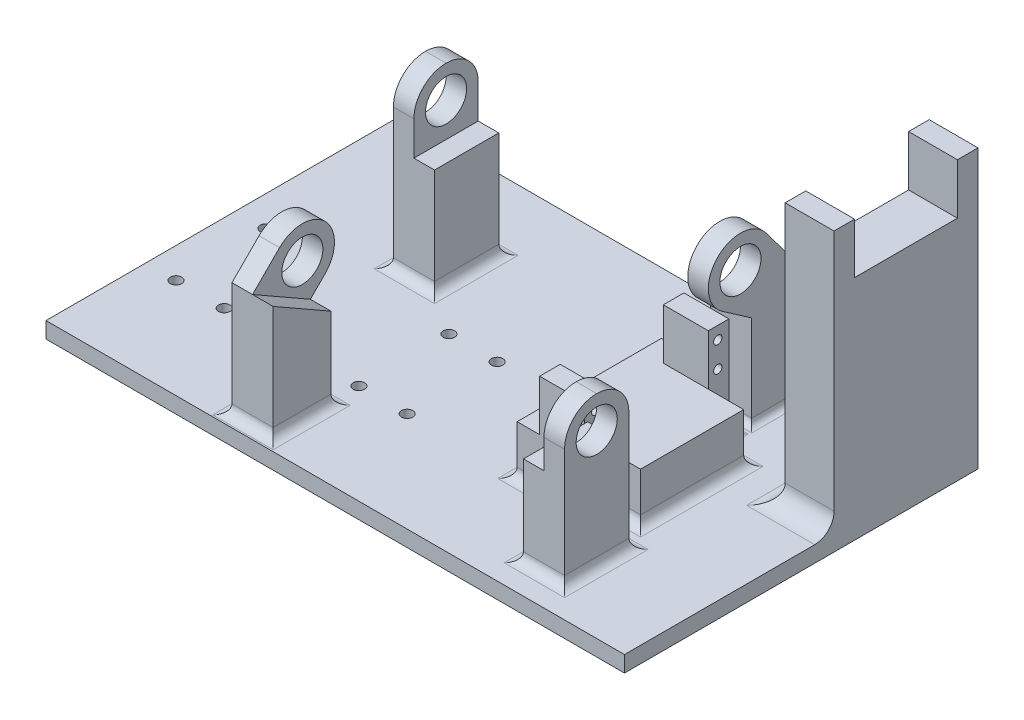
from build123d import *

# Parameters (mm, degrees)
SKETCH2_W            = 228.6
SKETCH2_H            = 139.7
BOSS_EXTRUDE1_DEPTH  = 6.35
SKETCH3_W            = 8.128
SKETCH3_H            = 25.4
BOSS_EXTRUDE2_DEPTH  = 59.69
FILLET3_R            = 12.7
SKETCH5_R            = 8.128
CUT_EXTRUDE1_DEPTH   = 53.34
SKETCH7_W            = 8.128
SKETCH7_H            = 25.4
BOSS_EXTRUDE3_DEPTH  = 35.56
SKETCH8_W            = 8.128
SKETCH8_H            = 22.86
BOSS_EXTRUDE4_DEPTH  = 25.4
BOSS_EXTRUDE5_DEPTH  = 8.128
FILLET4_R            = 12.7
CUT_EXTRUDE2_START   = -8.128
SKETCH10_R           = 8.128
CUT_EXTRUDE2_DEPTH   = 8.128
SKETCH11_W           = 8.128
SKETCH11_H           = 22.86
BOSS_EXTRUDE6_DEPTH  = 32.204488
BOSS_EXTRUDE7_DEPTH  = 8.128
SKETCH13_W           = 40.64
SKETCH13_H           = 40.767
BOSS_EXTRUDE8_DEPTH  = 19.433424
SKETCH14_W           = 26.67
SKETCH14_H           = 8.128
BOSS_EXTRUDE9_DEPTH  = 39.433424
FILLET6_R            = 3.81
SKETCH15_R           = 1.651
CUT_EXTRUDE3_DEPTH   = 12.7
CUT_EXTRUDE4_START   = -20
SKETCH16_W           = 8.89
SKETCH16_H           = 8.128
CUT_EXTRUDE4_DEPTH   = 20
SKETCH17_W           = 8.128
SKETCH17_H           = 25.4
BOSS_EXTRUDE10_DEPTH = 68.072
FILLET7_R            = 12.7
SKETCH20_R           = 8.128
CUT_EXTRUDE5_DEPTH   = 17.78
SKETCH21_W           = 8.128
SKETCH21_H           = 25.4
BOSS_EXTRUDE11_DEPTH = 41.91
FILLET8_R            = 3.81
SKETCH22_W           = 8.128
SKETCH22_H           = 25.4
BOSS_EXTRUDE12_DEPTH = 36.83
BOSS_EXTRUDE13_START = -8.128
SKETCH23_R           = 8.128
BOSS_EXTRUDE13_DEPTH = 8.128
SKETCH24_W           = 8.128
SKETCH24_H           = 25.4
BOSS_EXTRUDE14_DEPTH = 36.83
FILLET10_R           = 2.54
SKETCH26_W           = 19.304
SKETCH26_H           = 56.896
BOSS_EXTRUDE15_DEPTH = 83.546431338
SKETCH27_W           = 19.304
SKETCH27_H           = 8.128
BOSS_EXTRUDE16_DEPTH = 20
SKETCH28_R           = 1.625
CUT_EXTRUDE6_DEPTH   = 8.89
FILLET11_R           = 7.62
SKETCH29_R           = 2.249999945
CUT_EXTRUDE7_DEPTH   = 11.43


# Some blends are built 0.0001 mm under size
with BuildPart() as part:
    # Sketch2 → Boss-Extrude1 (new body)
    with BuildSketch(Plane(origin=(0, 0, 0), x_dir=(1, 0, 0), z_dir=(0, 1, 0))):
        with Locations((-33.692352941, -26.268455882)):
            Rectangle(SKETCH2_W, SKETCH2_H)
    extrude(amount=BOSS_EXTRUDE1_DEPTH)

    # Sketch3 → Boss-Extrude2 (add)
    with BuildSketch(Plane(origin=(0, 6.35, 0), x_dir=(1, 0, 0), z_dir=(0, 1, 0))):
        with Locations((41.440900604, -71.988455882)):
            Rectangle(SKETCH3_W, SKETCH3_H)
    extrude(amount=BOSS_EXTRUDE2_DEPTH)

    # Fillet3
    fillet3_edges = [part.edges().sort_by_distance(p)[0] for p in [
        (41.440900604, 66.04, 84.688455882),
        (41.440900604, 66.04, 59.288455882),
    ]]
    fillet(fillet3_edges, radius=FILLET3_R - 0.0001)  # a hair under: the kernel refuses the full size

    # Sketch5 → Cut-Extrude1 (cut)
    with BuildSketch(Plane(origin=(45.504900604, 0, 0), x_dir=(0, 0, -1), z_dir=(1, 0, 0))):
        with Locations((-71.988455882, 53.34)):
            Circle(SKETCH5_R)
    extrude(amount=-CUT_EXTRUDE1_DEPTH, mode=Mode.SUBTRACT)

    # Sketch7 → Boss-Extrude3 (add)
    with BuildSketch(Plane(origin=(0, 6.35, 0), x_dir=(1, 0, 0), z_dir=(0, 1, 0))):
        with Locations((33.312900604, -71.988455882)):
            Rectangle(SKETCH7_W, SKETCH7_H)
    extrude(amount=BOSS_EXTRUDE3_DEPTH)

    # Sketch8 → Boss-Extrude4 (add)
    with BuildSketch(Plane(origin=(0, 6.35, 0), x_dir=(1, 0, 0), z_dir=(0, 1, 0))):
        with Locations((-74.891099396, -80.243455882)):
            Rectangle(SKETCH8_W, SKETCH8_H)
    extrude(amount=BOSS_EXTRUDE4_DEPTH)

    # Sketch9 → Boss-Extrude5 (add)
    with BuildSketch(Plane.ZY.offset(78.955099396)):
        Polygon((91.673455882, 31.75), (91.673455882, 51.615512242), (71.988455882, 71.300512242), (54.02794364, 53.34), (68.813455882, 38.554487758), (68.813455882, 31.75), align=None)
    extrude(amount=-BOSS_EXTRUDE5_DEPTH)

    # Fillet4
    fillet4_edges = [part.edges().sort_by_distance(p)[0] for p in [
        (-74.891099396, 53.34, 54.02794364),
        (-74.891099396, 71.300512242, 71.988455882),
    ]]
    fillet(fillet4_edges, radius=FILLET4_R - 0.0001)  # a hair under: the kernel refuses the full size

    # Sketch10 → Cut-Extrude2 (cut)
    with BuildSketch(Plane.ZY.offset(78.955099396).offset(CUT_EXTRUDE2_START)):
        with Locations(Location((71.988455882, 53.34, 0), (0, 0, 180))):
            Circle(SKETCH10_R)
    extrude(amount=CUT_EXTRUDE2_DEPTH, mode=Mode.SUBTRACT)

    # Sketch11 → Boss-Extrude6 (add)
    with BuildSketch(Plane(origin=(0, 6.35, 0), x_dir=(1, 0, 0), z_dir=(0, 1, 0))):
        with Locations((-66.763099396, -80.243455882)):
            Rectangle(SKETCH11_W, SKETCH11_H)
    extrude(amount=BOSS_EXTRUDE6_DEPTH)

    # Sketch12 → Boss-Extrude7 (add)
    with BuildSketch(Plane(origin=(-70.827099396, 0, 0), x_dir=(0, 0, -1), z_dir=(1, 0, 0))):
        Polygon((-91.673455882, 51.615512242), (-68.813455882, 38.554487758), (-91.673455882, 38.554487758), align=None)
    extrude(amount=BOSS_EXTRUDE7_DEPTH)

    # Sketch13 → Boss-Extrude8 (add)
    with BuildSketch(Plane(origin=(0, 6.35, 0), x_dir=(1, 0, 0), z_dir=(0, 1, 0))):
        with Locations((19.450377632, -28.554455882)):
            Rectangle(SKETCH13_W, SKETCH13_H)
    extrude(amount=BOSS_EXTRUDE8_DEPTH)

    # Sketch14 → Boss-Extrude9 (add)
    with BuildSketch(Plane(origin=(0, 6.35, 0), x_dir=(1, 0, 0), z_dir=(0, 1, 0))):
        with Locations((12.465377632, -53.001955882)):
            Rectangle(SKETCH14_W, SKETCH14_H)
        with Locations((12.465377632, -4.106955882)):
            Rectangle(SKETCH14_W, SKETCH14_H)
    extrude(amount=BOSS_EXTRUDE9_DEPTH)

    # Fillet6
    # the kernel refuses this fillet: 3.81 mm, written as the material it adds along each edge
    with BuildSketch(Plane(origin=(-62.699099396, 6.35, 91.673455882), x_dir=(1, 0, 0), z_dir=(0, 0, -1)), Plane(origin=(-78.955099396, 6.35, 68.813455882), x_dir=(-1, 0, 0), z_dir=(0, 0, 1))) as fillet6_piece_1:
        with BuildLine():
            CenterArc((FILLET6_R, -FILLET6_R), FILLET6_R, 90, 90)
            Line((0, -FILLET6_R), (0, 0))
            Line((0, 0), (FILLET6_R, 0))
        make_face()
    extrude(amount=22.86)
    with BuildSketch(Plane(origin=(-0.869622368, 6.35, 57.065955882), x_dir=(-1, 0, 0), z_dir=(0, 0, -1))) as fillet6_piece_2:
        with BuildLine():
            CenterArc((FILLET6_R, FILLET6_R), FILLET6_R, 180, 90)
            Line((0, FILLET6_R), (0, 0))
            Line((0, 0), (FILLET6_R, 0))
        make_face()
    extrude(amount=57.023)
    with BuildSketch(Plane(origin=(39.770377632, 6.35, 48.937955882), x_dir=(1, 0, 0), z_dir=(0, 0, -1))) as fillet6_piece_3:
        with BuildLine():
            CenterArc((FILLET6_R, -FILLET6_R), FILLET6_R, 90, 90)
            Line((0, -FILLET6_R), (0, 0))
            Line((0, 0), (FILLET6_R, 0))
        make_face()
    extrude(amount=40.767)
    with BuildSketch(Plane(origin=(39.770377632, 6.35, 8.170955882), x_dir=(0, 0, -1), z_dir=(-1, 0, 0)), Plane(origin=(16.275377632, 6.35, 48.937955882), x_dir=(0, 0, 1), z_dir=(1, 0, 0))) as fillet6_piece_4:
        with BuildLine():
            CenterArc((FILLET6_R, -FILLET6_R), FILLET6_R, 90, 90)
            Line((0, -FILLET6_R), (0, 0))
            Line((0, 0), (FILLET6_R, 0))
        make_face()
    extrude(amount=23.495)
    with BuildSketch(Plane(origin=(25.800377632, 6.35, 57.065955882), x_dir=(0, 0, 1), z_dir=(-1, 0, 0))) as fillet6_piece_5:
        with BuildLine():
            CenterArc((FILLET6_R, FILLET6_R), FILLET6_R, 180, 90)
            Line((0, FILLET6_R), (0, 0))
            Line((0, 0), (FILLET6_R, 0))
        make_face()
    extrude(amount=26.67)
    with BuildSketch(Plane(origin=(25.800377632, 6.35, 39.412955882), x_dir=(1, 0, 0), z_dir=(0, 0, 1))) as fillet6_piece_6:
        with BuildLine():
            CenterArc((FILLET6_R, FILLET6_R), FILLET6_R, 180, 90)
            Line((0, FILLET6_R), (0, 0))
            Line((0, 0), (FILLET6_R, 0))
        make_face()
    extrude(amount=17.653)
    with BuildSketch(Plane(origin=(25.800377632, 6.35, 17.695955882), x_dir=(1, 0, 0), z_dir=(0, 0, -1))) as fillet6_piece_7:
        with BuildLine():
            CenterArc((FILLET6_R, -FILLET6_R), FILLET6_R, 90, 90)
            Line((0, -FILLET6_R), (0, 0))
            Line((0, 0), (FILLET6_R, 0))
        make_face()
    extrude(amount=17.653)
    with BuildSketch(Plane(origin=(25.800377632, 6.35, 0.042955882), x_dir=(0, 0, -1), z_dir=(-1, 0, 0))) as fillet6_piece_8:
        with BuildLine():
            CenterArc((FILLET6_R, -FILLET6_R), FILLET6_R, 90, 90)
            Line((0, -FILLET6_R), (0, 0))
            Line((0, 0), (FILLET6_R, 0))
        make_face()
    extrude(amount=26.67)
    with BuildSketch(Plane(origin=(45.504900604, 6.35, 84.688455882), x_dir=(0, 0, 1), z_dir=(-1, 0, 0))) as fillet6_piece_9:
        with BuildLine():
            CenterArc((FILLET6_R, FILLET6_R), FILLET6_R, 180, 90)
            Line((0, FILLET6_R), (0, 0))
            Line((0, 0), (FILLET6_R, 0))
        make_face()
    extrude(amount=16.256)
    with BuildSketch(Plane(origin=(45.504900604, 6.35, 59.288455882), x_dir=(1, 0, 0), z_dir=(0, 0, 1))) as fillet6_piece_10:
        with BuildLine():
            CenterArc((FILLET6_R, FILLET6_R), FILLET6_R, 180, 90)
            Line((0, FILLET6_R), (0, 0))
            Line((0, 0), (FILLET6_R, 0))
        make_face()
    extrude(amount=25.4)
    with BuildSketch(Plane(origin=(45.504900604, 6.35, 59.288455882), x_dir=(0, 0, -1), z_dir=(-1, 0, 0)), Plane(origin=(-62.699099396, 6.35, 68.813455882), x_dir=(0, 0, -1), z_dir=(-1, 0, 0)), Plane(origin=(-62.699099396, 6.35, 91.673455882), x_dir=(0, 1, 0), z_dir=(-1, 0, 0))) as fillet6_piece_11:
        with BuildLine():
            CenterArc((FILLET6_R, -FILLET6_R), FILLET6_R, 90, 90)
            Line((0, -FILLET6_R), (0, 0))
            Line((0, 0), (FILLET6_R, 0))
        make_face()
    extrude(amount=16.256)
    with BuildSketch(Plane(origin=(29.248900604, 6.35, 59.288455882), x_dir=(-1, 0, 0), z_dir=(0, 0, 1))) as fillet6_piece_12:
        with BuildLine():
            CenterArc((FILLET6_R, -FILLET6_R), FILLET6_R, 90, 90)
            Line((0, -FILLET6_R), (0, 0))
            Line((0, 0), (FILLET6_R, 0))
        make_face()
    extrude(amount=25.4)
    with BuildSketch(Plane(origin=(-53.174099396, 6.35, 91.673455882), x_dir=(0, 1, 0), z_dir=(-1, 0, 0))) as fillet6_piece_13a_section:
        with BuildLine():
            CenterArc((FILLET6_R, -FILLET6_R), FILLET6_R, 90, 90)
            Line((0, -FILLET6_R), (0, 0))
            Line((0, 0), (FILLET6_R, 0))
        make_face()
    fillet6_piece_13a = extrude(amount=25.781, mode=Mode.PRIVATE)
    fillet6_piece_13a = split(fillet6_piece_13a, bisect_by=Plane(origin=(-62.699099396, 7.212565385, 92.536021268), z_dir=(1, 0, 0)), keep=Keep.TOP, mode=Mode.PRIVATE)
    with BuildSketch(Plane(origin=(-62.699099396, 6.35, 101.198455882), x_dir=(1, 0, 0), z_dir=(0, 0, -1))) as fillet6_piece_13b_section:
        with BuildLine():
            CenterArc((FILLET6_R, -FILLET6_R), FILLET6_R, 90, 90)
            Line((0, -FILLET6_R), (0, 0))
            Line((0, 0), (FILLET6_R, 0))
        make_face()
    fillet6_piece_13b = extrude(amount=32.385, mode=Mode.PRIVATE)
    fillet6_piece_13b = split(fillet6_piece_13b, bisect_by=Plane(origin=(-61.83653401, 7.212565385, 91.673455882), z_dir=(0, 0, 1)), keep=Keep.TOP, mode=Mode.PRIVATE)
    fillet6_piece_13b = split(fillet6_piece_13b, bisect_by=Plane(origin=(-61.83653401, 7.212565385, 96.118455882), z_dir=(0, 0, -1)), keep=Keep.TOP, mode=Mode.PRIVATE)
    fillet6_piece_13 = fillet6_piece_13a & fillet6_piece_13b
    add(fillet6_piece_13)
    with BuildSketch(Plane(origin=(-62.699099396, 6.35, 91.673455882), x_dir=(1, 0, 0), z_dir=(0, 0, -1))) as fillet6_piece_14a_section:
        with BuildLine():
            CenterArc((FILLET6_R, -FILLET6_R), FILLET6_R, 90, 90)
            Line((0, -FILLET6_R), (0, 0))
            Line((0, 0), (FILLET6_R, 0))
        make_face()
    fillet6_piece_14a = extrude(amount=32.385, mode=Mode.PRIVATE)
    fillet6_piece_14a = split(fillet6_piece_14a, bisect_by=Plane(origin=(-61.83653401, 7.212565385, 68.813455882), z_dir=(0, 0, -1)), keep=Keep.TOP, mode=Mode.PRIVATE)
    with BuildSketch(Plane(origin=(-53.174099396, 6.35, 68.813455882), x_dir=(0, 0, -1), z_dir=(-1, 0, 0))) as fillet6_piece_14b_section:
        with BuildLine():
            CenterArc((FILLET6_R, -FILLET6_R), FILLET6_R, 90, 90)
            Line((0, -FILLET6_R), (0, 0))
            Line((0, 0), (FILLET6_R, 0))
        make_face()
    fillet6_piece_14b = extrude(amount=25.781, mode=Mode.PRIVATE)
    fillet6_piece_14b = split(fillet6_piece_14b, bisect_by=Plane(origin=(-62.699099396, 7.212565385, 67.950890497), z_dir=(1, 0, 0)), keep=Keep.TOP, mode=Mode.PRIVATE)
    fillet6_piece_14 = fillet6_piece_14a & fillet6_piece_14b
    add(fillet6_piece_14)
    with BuildSketch(Plane(origin=(-0.869622368, 6.35, 66.590955882), x_dir=(-1, 0, 0), z_dir=(0, 0, -1))) as fillet6_piece_15a_section:
        with BuildLine():
            CenterArc((FILLET6_R, FILLET6_R), FILLET6_R, 180, 90)
            Line((0, FILLET6_R), (0, 0))
            Line((0, 0), (FILLET6_R, 0))
        make_face()
    fillet6_piece_15a = extrude(amount=66.548, mode=Mode.PRIVATE)
    fillet6_piece_15a = split(fillet6_piece_15a, bisect_by=Plane(origin=(-1.732187754, 7.212565385, 57.065955882), z_dir=(0, 0, 1)), keep=Keep.TOP, mode=Mode.PRIVATE)
    with BuildSketch(Plane(origin=(25.800377632, 6.35, 57.065955882), x_dir=(0, 0, 1), z_dir=(-1, 0, 0))) as fillet6_piece_15b_section:
        with BuildLine():
            CenterArc((FILLET6_R, FILLET6_R), FILLET6_R, 180, 90)
            Line((0, FILLET6_R), (0, 0))
            Line((0, 0), (FILLET6_R, 0))
        make_face()
    fillet6_piece_15b = extrude(amount=36.195, mode=Mode.PRIVATE)
    fillet6_piece_15b = split(fillet6_piece_15b, bisect_by=Plane(origin=(-0.869622368, 7.212565385, 57.928521268), z_dir=(-1, 0, 0)), keep=Keep.TOP, mode=Mode.PRIVATE)
    fillet6_piece_15 = fillet6_piece_15a & fillet6_piece_15b
    add(fillet6_piece_15)
    with BuildSketch(Plane(origin=(25.800377632, 6.35, 0.042955882), x_dir=(0, 0, -1), z_dir=(-1, 0, 0))) as fillet6_piece_16a_section:
        with BuildLine():
            CenterArc((FILLET6_R, -FILLET6_R), FILLET6_R, 90, 90)
            Line((0, -FILLET6_R), (0, 0))
            Line((0, 0), (FILLET6_R, 0))
        make_face()
    fillet6_piece_16a = extrude(amount=36.195, mode=Mode.PRIVATE)
    fillet6_piece_16a = split(fillet6_piece_16a, bisect_by=Plane(origin=(-0.869622368, 7.212565385, -0.819609503), z_dir=(-1, 0, 0)), keep=Keep.TOP, mode=Mode.PRIVATE)
    with BuildSketch(Plane(origin=(-0.869622368, 6.35, 57.065955882), x_dir=(-1, 0, 0), z_dir=(0, 0, -1))) as fillet6_piece_16b_section:
        with BuildLine():
            CenterArc((FILLET6_R, FILLET6_R), FILLET6_R, 180, 90)
            Line((0, FILLET6_R), (0, 0))
            Line((0, 0), (FILLET6_R, 0))
        make_face()
    fillet6_piece_16b = extrude(amount=66.548, mode=Mode.PRIVATE)
    fillet6_piece_16b = split(fillet6_piece_16b, bisect_by=Plane(origin=(-1.732187754, 7.212565385, 0.042955882), z_dir=(0, 0, -1)), keep=Keep.TOP, mode=Mode.PRIVATE)
    fillet6_piece_16 = fillet6_piece_16a & fillet6_piece_16b
    add(fillet6_piece_16)
    with BuildSketch(Plane(origin=(25.800377632, 6.35, 48.937955882), x_dir=(0, 0, 1), z_dir=(1, 0, 0))) as fillet6_piece_17a_section:
        with BuildLine():
            CenterArc((FILLET6_R, -FILLET6_R), FILLET6_R, 90, 90)
            Line((0, -FILLET6_R), (0, 0))
            Line((0, 0), (FILLET6_R, 0))
        make_face()
    fillet6_piece_17a = extrude(amount=23.495, mode=Mode.PRIVATE)
    fillet6_piece_17a = split(fillet6_piece_17a, bisect_by=Plane(origin=(39.770377632, 7.212565385, 49.800521268), z_dir=(1, 0, 0)), keep=Keep.TOP, mode=Mode.PRIVATE)
    with BuildSketch(Plane(origin=(39.770377632, 6.35, 58.462955882), x_dir=(1, 0, 0), z_dir=(0, 0, -1))) as fillet6_piece_17b_section:
        with BuildLine():
            CenterArc((FILLET6_R, -FILLET6_R), FILLET6_R, 90, 90)
            Line((0, -FILLET6_R), (0, 0))
            Line((0, 0), (FILLET6_R, 0))
        make_face()
    fillet6_piece_17b = extrude(amount=50.292, mode=Mode.PRIVATE)
    fillet6_piece_17b = split(fillet6_piece_17b, bisect_by=Plane(origin=(40.632943017, 7.212565385, 48.937955882), z_dir=(0, 0, 1)), keep=Keep.TOP, mode=Mode.PRIVATE)
    fillet6_piece_17 = fillet6_piece_17a & fillet6_piece_17b
    add(fillet6_piece_17)
    with BuildSketch(Plane(origin=(39.770377632, 6.35, 48.937955882), x_dir=(1, 0, 0), z_dir=(0, 0, -1))) as fillet6_piece_18a_section:
        with BuildLine():
            CenterArc((FILLET6_R, -FILLET6_R), FILLET6_R, 90, 90)
            Line((0, -FILLET6_R), (0, 0))
            Line((0, 0), (FILLET6_R, 0))
        make_face()
    fillet6_piece_18a = extrude(amount=50.292, mode=Mode.PRIVATE)
    fillet6_piece_18a = split(fillet6_piece_18a, bisect_by=Plane(origin=(40.632943017, 7.212565385, 8.170955882), z_dir=(0, 0, -1)), keep=Keep.TOP, mode=Mode.PRIVATE)
    with BuildSketch(Plane(origin=(49.295377632, 6.35, 8.170955882), x_dir=(0, 0, -1), z_dir=(-1, 0, 0))) as fillet6_piece_18b_section:
        with BuildLine():
            CenterArc((FILLET6_R, -FILLET6_R), FILLET6_R, 90, 90)
            Line((0, -FILLET6_R), (0, 0))
            Line((0, 0), (FILLET6_R, 0))
        make_face()
    fillet6_piece_18b = extrude(amount=23.495, mode=Mode.PRIVATE)
    fillet6_piece_18b = split(fillet6_piece_18b, bisect_by=Plane(origin=(39.770377632, 7.212565385, 7.308390497), z_dir=(1, 0, 0)), keep=Keep.TOP, mode=Mode.PRIVATE)
    fillet6_piece_18 = fillet6_piece_18a & fillet6_piece_18b
    add(fillet6_piece_18)
    with BuildSketch(Plane(origin=(35.325377632, 6.35, 57.065955882), x_dir=(0, 0, 1), z_dir=(-1, 0, 0))) as fillet6_piece_19a_section:
        with BuildLine():
            CenterArc((FILLET6_R, FILLET6_R), FILLET6_R, 180, 90)
            Line((0, FILLET6_R), (0, 0))
            Line((0, 0), (FILLET6_R, 0))
        make_face()
    fillet6_piece_19a = extrude(amount=36.195, mode=Mode.PRIVATE)
    fillet6_piece_19a = split(fillet6_piece_19a, bisect_by=Plane(origin=(25.800377632, 7.212565385, 57.928521268), z_dir=(1, 0, 0)), keep=Keep.TOP, mode=Mode.PRIVATE)
    with BuildSketch(Plane(origin=(25.800377632, 6.35, 48.937955882), x_dir=(1, 0, 0), z_dir=(0, 0, 1))) as fillet6_piece_19b_section:
        with BuildLine():
            CenterArc((FILLET6_R, FILLET6_R), FILLET6_R, 180, 90)
            Line((0, FILLET6_R), (0, 0))
            Line((0, 0), (FILLET6_R, 0))
        make_face()
    fillet6_piece_19b = extrude(amount=17.653, mode=Mode.PRIVATE)
    fillet6_piece_19b = split(fillet6_piece_19b, bisect_by=Plane(origin=(26.662943017, 7.212565385, 57.065955882), z_dir=(0, 0, 1)), keep=Keep.TOP, mode=Mode.PRIVATE)
    fillet6_piece_19 = fillet6_piece_19a & fillet6_piece_19b
    add(fillet6_piece_19)
    with BuildSketch(Plane(origin=(35.325377632, 6.35, 0.042955882), x_dir=(0, 0, -1), z_dir=(-1, 0, 0))) as fillet6_piece_20a_section:
        with BuildLine():
            CenterArc((FILLET6_R, -FILLET6_R), FILLET6_R, 90, 90)
            Line((0, -FILLET6_R), (0, 0))
            Line((0, 0), (FILLET6_R, 0))
        make_face()
    fillet6_piece_20a = extrude(amount=36.195, mode=Mode.PRIVATE)
    fillet6_piece_20a = split(fillet6_piece_20a, bisect_by=Plane(origin=(25.800377632, 7.212565385, -0.819609503), z_dir=(1, 0, 0)), keep=Keep.TOP, mode=Mode.PRIVATE)
    with BuildSketch(Plane(origin=(25.800377632, 6.35, 8.170955882), x_dir=(1, 0, 0), z_dir=(0, 0, -1))) as fillet6_piece_20b_section:
        with BuildLine():
            CenterArc((FILLET6_R, -FILLET6_R), FILLET6_R, 90, 90)
            Line((0, -FILLET6_R), (0, 0))
            Line((0, 0), (FILLET6_R, 0))
        make_face()
    fillet6_piece_20b = extrude(amount=17.653, mode=Mode.PRIVATE)
    fillet6_piece_20b = split(fillet6_piece_20b, bisect_by=Plane(origin=(26.662943017, 7.212565385, 0.042955882), z_dir=(0, 0, -1)), keep=Keep.TOP, mode=Mode.PRIVATE)
    fillet6_piece_20 = fillet6_piece_20a & fillet6_piece_20b
    add(fillet6_piece_20)
    with BuildSketch(Plane(origin=(55.029900604, 6.35, 84.688455882), x_dir=(0, 0, 1), z_dir=(-1, 0, 0))) as fillet6_piece_21a_section:
        with BuildLine():
            CenterArc((FILLET6_R, FILLET6_R), FILLET6_R, 180, 90)
            Line((0, FILLET6_R), (0, 0))
            Line((0, 0), (FILLET6_R, 0))
        make_face()
    fillet6_piece_21a = extrude(amount=25.781, mode=Mode.PRIVATE)
    fillet6_piece_21a = split(fillet6_piece_21a, bisect_by=Plane(origin=(45.504900604, 7.212565385, 85.551021268), z_dir=(1, 0, 0)), keep=Keep.TOP, mode=Mode.PRIVATE)
    with BuildSketch(Plane(origin=(45.504900604, 6.35, 59.288455882), x_dir=(1, 0, 0), z_dir=(0, 0, 1))) as fillet6_piece_21b_section:
        with BuildLine():
            CenterArc((FILLET6_R, FILLET6_R), FILLET6_R, 180, 90)
            Line((0, FILLET6_R), (0, 0))
            Line((0, 0), (FILLET6_R, 0))
        make_face()
    fillet6_piece_21b = extrude(amount=34.925, mode=Mode.PRIVATE)
    fillet6_piece_21b = split(fillet6_piece_21b, bisect_by=Plane(origin=(46.36746599, 7.212565385, 84.688455882), z_dir=(0, 0, 1)), keep=Keep.TOP, mode=Mode.PRIVATE)
    fillet6_piece_21 = fillet6_piece_21a & fillet6_piece_21b
    add(fillet6_piece_21)
    with BuildSketch(Plane(origin=(29.248900604, 6.35, 59.288455882), x_dir=(-1, 0, 0), z_dir=(0, 0, 1))) as fillet6_piece_22a_section:
        with BuildLine():
            CenterArc((FILLET6_R, -FILLET6_R), FILLET6_R, 90, 90)
            Line((0, -FILLET6_R), (0, 0))
            Line((0, 0), (FILLET6_R, 0))
        make_face()
    fillet6_piece_22a = extrude(amount=34.925, mode=Mode.PRIVATE)
    fillet6_piece_22a = split(fillet6_piece_22a, bisect_by=Plane(origin=(28.386335219, 7.212565385, 84.688455882), z_dir=(0, 0, 1)), keep=Keep.TOP, mode=Mode.PRIVATE)
    with BuildSketch(Plane(origin=(45.504900604, 6.35, 84.688455882), x_dir=(0, 0, 1), z_dir=(-1, 0, 0))) as fillet6_piece_22b_section:
        with BuildLine():
            CenterArc((FILLET6_R, FILLET6_R), FILLET6_R, 180, 90)
            Line((0, FILLET6_R), (0, 0))
            Line((0, 0), (FILLET6_R, 0))
        make_face()
    fillet6_piece_22b = extrude(amount=25.781, mode=Mode.PRIVATE)
    fillet6_piece_22b = split(fillet6_piece_22b, bisect_by=Plane(origin=(29.248900604, 7.212565385, 85.551021268), z_dir=(-1, 0, 0)), keep=Keep.TOP, mode=Mode.PRIVATE)
    fillet6_piece_22 = fillet6_piece_22a & fillet6_piece_22b
    add(fillet6_piece_22)
    with BuildSketch(Plane(origin=(55.029900604, 6.35, 59.288455882), x_dir=(0, 0, -1), z_dir=(-1, 0, 0))) as fillet6_piece_23a_section:
        with BuildLine():
            CenterArc((FILLET6_R, -FILLET6_R), FILLET6_R, 90, 90)
            Line((0, -FILLET6_R), (0, 0))
            Line((0, 0), (FILLET6_R, 0))
        make_face()
    fillet6_piece_23a = extrude(amount=25.781, mode=Mode.PRIVATE)
    fillet6_piece_23a = split(fillet6_piece_23a, bisect_by=Plane(origin=(45.504900604, 7.212565385, 58.425890497), z_dir=(1, 0, 0)), keep=Keep.TOP, mode=Mode.PRIVATE)
    with BuildSketch(Plane(origin=(45.504900604, 6.35, 49.763455882), x_dir=(1, 0, 0), z_dir=(0, 0, 1))) as fillet6_piece_23b_section:
        with BuildLine():
            CenterArc((FILLET6_R, FILLET6_R), FILLET6_R, 180, 90)
            Line((0, FILLET6_R), (0, 0))
            Line((0, 0), (FILLET6_R, 0))
        make_face()
    fillet6_piece_23b = extrude(amount=34.925, mode=Mode.PRIVATE)
    fillet6_piece_23b = split(fillet6_piece_23b, bisect_by=Plane(origin=(46.36746599, 7.212565385, 59.288455882), z_dir=(0, 0, -1)), keep=Keep.TOP, mode=Mode.PRIVATE)
    fillet6_piece_23 = fillet6_piece_23a & fillet6_piece_23b
    add(fillet6_piece_23)
    with BuildSketch(Plane(origin=(45.504900604, 6.35, 59.288455882), x_dir=(0, 0, -1), z_dir=(-1, 0, 0))) as fillet6_piece_24a_section:
        with BuildLine():
            CenterArc((FILLET6_R, -FILLET6_R), FILLET6_R, 90, 90)
            Line((0, -FILLET6_R), (0, 0))
            Line((0, 0), (FILLET6_R, 0))
        make_face()
    fillet6_piece_24a = extrude(amount=25.781, mode=Mode.PRIVATE)
    fillet6_piece_24a = split(fillet6_piece_24a, bisect_by=Plane(origin=(29.248900604, 7.212565385, 58.425890497), z_dir=(-1, 0, 0)), keep=Keep.TOP, mode=Mode.PRIVATE)
    with BuildSketch(Plane(origin=(29.248900604, 6.35, 49.763455882), x_dir=(-1, 0, 0), z_dir=(0, 0, 1))) as fillet6_piece_24b_section:
        with BuildLine():
            CenterArc((FILLET6_R, -FILLET6_R), FILLET6_R, 90, 90)
            Line((0, -FILLET6_R), (0, 0))
            Line((0, 0), (FILLET6_R, 0))
        make_face()
    fillet6_piece_24b = extrude(amount=34.925, mode=Mode.PRIVATE)
    fillet6_piece_24b = split(fillet6_piece_24b, bisect_by=Plane(origin=(28.386335219, 7.212565385, 59.288455882), z_dir=(0, 0, -1)), keep=Keep.TOP, mode=Mode.PRIVATE)
    fillet6_piece_24 = fillet6_piece_24a & fillet6_piece_24b
    add(fillet6_piece_24)
    with BuildSketch(Plane(origin=(-78.955099396, 6.35, 59.288455882), x_dir=(-1, 0, 0), z_dir=(0, 0, 1))) as fillet6_piece_25a_section:
        with BuildLine():
            CenterArc((FILLET6_R, -FILLET6_R), FILLET6_R, 90, 90)
            Line((0, -FILLET6_R), (0, 0))
            Line((0, 0), (FILLET6_R, 0))
        make_face()
    fillet6_piece_25a = extrude(amount=32.385, mode=Mode.PRIVATE)
    fillet6_piece_25a = split(fillet6_piece_25a, bisect_by=Plane(origin=(-79.817664781, 7.212565385, 68.813455882), z_dir=(0, 0, -1)), keep=Keep.TOP, mode=Mode.PRIVATE)
    with BuildSketch(Plane(origin=(-62.699099396, 6.35, 68.813455882), x_dir=(0, 0, -1), z_dir=(-1, 0, 0))) as fillet6_piece_25b_section:
        with BuildLine():
            CenterArc((FILLET6_R, -FILLET6_R), FILLET6_R, 90, 90)
            Line((0, -FILLET6_R), (0, 0))
            Line((0, 0), (FILLET6_R, 0))
        make_face()
    fillet6_piece_25b = extrude(amount=25.781, mode=Mode.PRIVATE)
    fillet6_piece_25b = split(fillet6_piece_25b, bisect_by=Plane(origin=(-78.955099396, 7.212565385, 67.950890497), z_dir=(-1, 0, 0)), keep=Keep.TOP, mode=Mode.PRIVATE)
    fillet6_piece_25 = fillet6_piece_25a & fillet6_piece_25b
    add(fillet6_piece_25)
    with BuildSketch(Plane(origin=(-62.699099396, 6.35, 91.673455882), x_dir=(0, 1, 0), z_dir=(-1, 0, 0))) as fillet6_piece_26a_section:
        with BuildLine():
            CenterArc((FILLET6_R, -FILLET6_R), FILLET6_R, 90, 90)
            Line((0, -FILLET6_R), (0, 0))
            Line((0, 0), (FILLET6_R, 0))
        make_face()
    fillet6_piece_26a = extrude(amount=25.781, mode=Mode.PRIVATE)
    fillet6_piece_26a = split(fillet6_piece_26a, bisect_by=Plane(origin=(-78.955099396, 7.212565385, 92.536021268), z_dir=(-1, 0, 0)), keep=Keep.TOP, mode=Mode.PRIVATE)
    with BuildSketch(Plane(origin=(-78.955099396, 6.35, 68.813455882), x_dir=(-1, 0, 0), z_dir=(0, 0, 1))) as fillet6_piece_26b_section:
        with BuildLine():
            CenterArc((FILLET6_R, -FILLET6_R), FILLET6_R, 90, 90)
            Line((0, -FILLET6_R), (0, 0))
            Line((0, 0), (FILLET6_R, 0))
        make_face()
    fillet6_piece_26b = extrude(amount=32.385, mode=Mode.PRIVATE)
    fillet6_piece_26b = split(fillet6_piece_26b, bisect_by=Plane(origin=(-79.817664781, 7.212565385, 91.673455882), z_dir=(0, 0, 1)), keep=Keep.TOP, mode=Mode.PRIVATE)
    fillet6_piece_26b = split(fillet6_piece_26b, bisect_by=Plane(origin=(-79.817664781, 7.212565385, 96.118455882), z_dir=(0, 0, -1)), keep=Keep.TOP, mode=Mode.PRIVATE)
    fillet6_piece_26 = fillet6_piece_26a & fillet6_piece_26b
    add(fillet6_piece_26)

    # Sketch15 → Cut-Extrude3 (cut)
    with BuildSketch(Plane(origin=(25.800377632, 0, 0), x_dir=(0, 0, -1), z_dir=(1, 0, 0))):
        with Locations((-4.432332643, 40.783424315)):
            Circle(SKETCH15_R)
        with Locations((-4.432332643, 30.783424315)):
            Circle(SKETCH15_R)
        with Locations((-52.632332643, 40.783424315)):
            Circle(SKETCH15_R)
        with Locations((-52.632332643, 30.783424315)):
            Circle(SKETCH15_R)
    extrude(amount=-CUT_EXTRUDE3_DEPTH, mode=Mode.SUBTRACT)

    # Sketch16 → Cut-Extrude4 (cut)
    with BuildSketch(Plane(origin=(0, 45.783424315, 0), x_dir=(1, 0, 0), z_dir=(0, 1, 0)).offset(CUT_EXTRUDE4_START)):
        with Locations((3.575377632, -4.106955882)):
            Rectangle(SKETCH16_W, SKETCH16_H)
        with Locations((3.575377632, -53.001955882)):
            Rectangle(SKETCH16_W, SKETCH16_H)
    extrude(amount=CUT_EXTRUDE4_DEPTH, mode=Mode.SUBTRACT)

    # Sketch17 → Boss-Extrude10 (add)
    with BuildSketch(Plane(origin=(0, 6.35, 0), x_dir=(1, 0, 0), z_dir=(0, 1, 0))):
        with Locations((-93.022119832, 2.941544118)):
            Rectangle(SKETCH17_W, SKETCH17_H)
    extrude(amount=BOSS_EXTRUDE10_DEPTH)

    # Fillet7
    fillet7_edges = [part.edges().sort_by_distance(p)[0] for p in [
        (-93.022119832, 74.422, 9.758455882),
        (-93.022119832, 74.422, -15.641544118),
    ]]
    fillet(fillet7_edges, radius=FILLET7_R - 0.0001)  # a hair under: the kernel refuses the full size

    # Sketch20 → Cut-Extrude5 (cut)
    with BuildSketch(Plane(origin=(-88.958119832, 0, 0), x_dir=(0, 0, -1), z_dir=(1, 0, 0))):
        with Locations((2.941544118, 61.722)):
            Circle(SKETCH20_R)
    extrude(amount=-CUT_EXTRUDE5_DEPTH, mode=Mode.SUBTRACT)

    # Sketch21 → Boss-Extrude11 (add)
    with BuildSketch(Plane(origin=(0, 6.35, 0), x_dir=(1, 0, 0), z_dir=(0, 1, 0))):
        with Locations((-84.894119832, 2.941544118)):
            Rectangle(SKETCH21_W, SKETCH21_H)
    extrude(amount=BOSS_EXTRUDE11_DEPTH)

    # Fillet8
    fillet8_edges = [part.edges().sort_by_distance(p)[0] for p in [
        (-97.086119832, 6.35, -2.941544118),
        (-88.958119832, 6.35, 9.758455882),
        (-88.958119832, 6.35, -15.641544118),
        (-80.830119832, 6.35, -2.941544118),
    ]]
    fillet(fillet8_edges, radius=FILLET8_R)

    # Sketch22 → Boss-Extrude12 (add)
    with BuildSketch(Plane(origin=(0, 6.35, 0), x_dir=(1, 0, 0), z_dir=(0, 1, 0))):
        with Locations((23.309880168, 20.086544118)):
            Rectangle(SKETCH22_W, SKETCH22_H)
    extrude(amount=BOSS_EXTRUDE12_DEPTH)

    # Sketch23 → Boss-Extrude13 (add)
    with BuildSketch(Plane.ZY.offset(-19.245880168).offset(BOSS_EXTRUDE13_START)):
        with BuildLine():
            ThreePointArc((-13.089712347, 69.357750231), (6.209713529, 70.527934561), (4.29839934, 51.287766979))
            Line((4.29839934, 51.287766979), (-7.386544118, 43.18))
            Line((-7.386544118, 43.18), (-32.786544118, 43.18))
            Line((-32.786544118, 43.18), (-13.089712347, 69.357750231))
        make_face()
        with Locations(Location((-2.941544118, 61.722, 0), (0, 0, 179.999999999))):
            Circle(SKETCH23_R, mode=Mode.SUBTRACT)
    extrude(amount=BOSS_EXTRUDE13_DEPTH)

    # Sketch24 → Boss-Extrude14 (add)
    with BuildSketch(Plane(origin=(0, 6.35, 0), x_dir=(1, 0, 0), z_dir=(0, 1, 0))):
        with Locations((15.181880168, 20.086544118)):
            Rectangle(SKETCH24_W, SKETCH24_H)
    extrude(amount=BOSS_EXTRUDE14_DEPTH)

    # Fillet10
    fillet10_edges = [part.edges().sort_by_distance(p)[0] for p in [
        (27.373880168, 6.35, -20.086544118),
        (19.245880168, 6.35, -32.786544118),
        (19.245880168, 6.35, -7.386544118),
        (11.117880168, 6.35, -20.086544118),
    ]]
    fillet(fillet10_edges, radius=FILLET10_R)

    # Sketch26 → Boss-Extrude15 (add)
    with BuildSketch(Plane(origin=(0, 6.35, 0), x_dir=(1, 0, 0), z_dir=(0, 1, 0))):
        with Locations((70.955647059, 15.133544118)):
            Rectangle(SKETCH26_W, SKETCH26_H)
    extrude(amount=BOSS_EXTRUDE15_DEPTH)

    # Sketch27 → Boss-Extrude16 (add)
    with BuildSketch(Plane(origin=(0, 89.896431338, 0), x_dir=(1, 0, 0), z_dir=(0, 1, 0))):
        with Locations((70.955647059, -9.250455882)):
            Rectangle(SKETCH27_W, SKETCH27_H)
        with Locations((70.955647059, 39.517544118)):
            Rectangle(SKETCH27_W, SKETCH27_H)
    extrude(amount=BOSS_EXTRUDE16_DEPTH)

    # Sketch28 → Cut-Extrude6 (cut)
    with BuildSketch(Plane.ZY.offset(-61.303647059)):
        with Locations((8.900455882, 104.896431338)):
            Circle(SKETCH28_R)
        with Locations((8.900455882, 94.896431338)):
            Circle(SKETCH28_R)
        with Locations((-39.299544118, 104.896431338)):
            Circle(SKETCH28_R)
        with Locations((-39.299544118, 94.896431338)):
            Circle(SKETCH28_R)
    extrude(amount=-CUT_EXTRUDE6_DEPTH, mode=Mode.SUBTRACT)

    # Fillet11
    fillet11_edges = [part.edges().sort_by_distance(p)[0] for p in [
        (70.955647059, 6.35, 13.314455882),
        (61.303647059, 6.35, -15.133544118),
    ]]
    fillet(fillet11_edges, radius=FILLET11_R)

    # Sketch29 → Cut-Extrude7 (cut)
    with BuildSketch(Plane(origin=(0, 6.35, 0), x_dir=(1, 0, 0), z_dir=(0, 1, 0))):
        with Locations(Location((-136.056376411, -56.68306863, 0), (0, 0, 270))):
            Circle(SKETCH29_R)
        with Locations(Location((-117.006376411, -56.68306863, 0), (0, 0, 270))):
            Circle(SKETCH29_R)
        with Locations(Location((-136.056376411, -21.12306863, 0), (0, 0, 270))):
            Circle(SKETCH29_R)
        with Locations(Location((-117.006376411, -21.12306863, 0), (0, 0, 270))):
            Circle(SKETCH29_R)
        with Locations(Location((-44.712426268, -56.68306863, 0), (0, 0, 270))):
            Circle(SKETCH29_R)
        with Locations(Location((-63.762426268, -56.68306863, 0), (0, 0, 270))):
            Circle(SKETCH29_R)
        with Locations(Location((-44.712426268, -21.12306863, 0), (0, 0, 270))):
            Circle(SKETCH29_R)
        with Locations(Location((-63.762426268, -21.12306863, 0), (0, 0, 270))):
            Circle(SKETCH29_R)
    extrude(amount=-CUT_EXTRUDE7_DEPTH, mode=Mode.SUBTRACT)


solid = part.part
